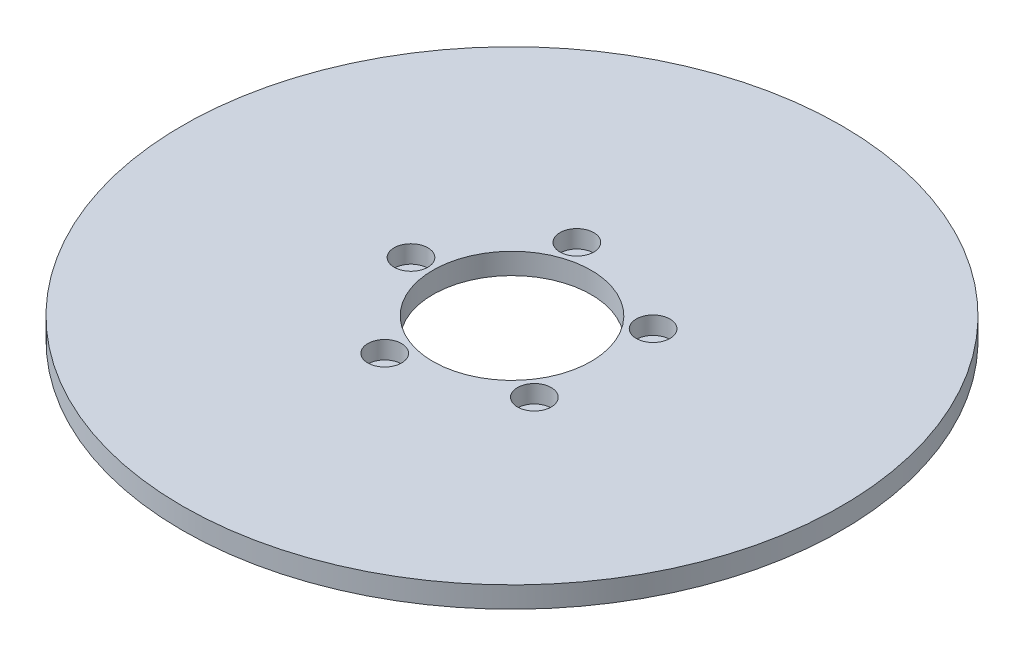
from build123d import *

# Parameters (mm, degrees)
SKETCH1_R           = 62.5
BOSS_EXTRUDE1_DEPTH = 4
SKETCH2_R           = 15
CUT_EXTRUDE1_DEPTH  = 89.478811023
SKETCH3_R           = 3.201429612
CUT_EXTRUDE2_DEPTH  = 3.36082526
CIRPATTERN1_COUNT   = 5


with BuildPart() as part:
    # Sketch1 → Boss-Extrude1 (new body)
    with BuildSketch(Plane(origin=(0, 0, 0), x_dir=(1, 0, 0), z_dir=(0, 1, 0))):
        Circle(SKETCH1_R)
    extrude(amount=BOSS_EXTRUDE1_DEPTH)

    # Sketch2 → Cut-Extrude1 (cut, through all)
    with BuildSketch(Plane(origin=(0, 0, 0), x_dir=(1, 0, 0), z_dir=(0, 1, 0))):
        Circle(SKETCH2_R)
    extrude(amount=CUT_EXTRUDE1_DEPTH, mode=Mode.SUBTRACT)

    # Sketch3 → Cut-Extrude2 (cut)
    with BuildSketch(Plane(origin=(0, 4, 0), x_dir=(1, 0, 0), z_dir=(0, 1, 0))):
        with Locations((-19.156498148, 0)):
            Circle(SKETCH3_R)
    cut_extrude2 = extrude(amount=-CUT_EXTRUDE2_DEPTH, mode=Mode.SUBTRACT)

    # CirPattern1: Cut-Extrude2 ×5 about axis
    cirpattern1_axis = Axis((0, 0, 0), (0, 1, 0))
    for i in range(1, CIRPATTERN1_COUNT):
        add(cut_extrude2.rotate(cirpattern1_axis, i * 360 / CIRPATTERN1_COUNT), mode=Mode.SUBTRACT)


solid = part.part
